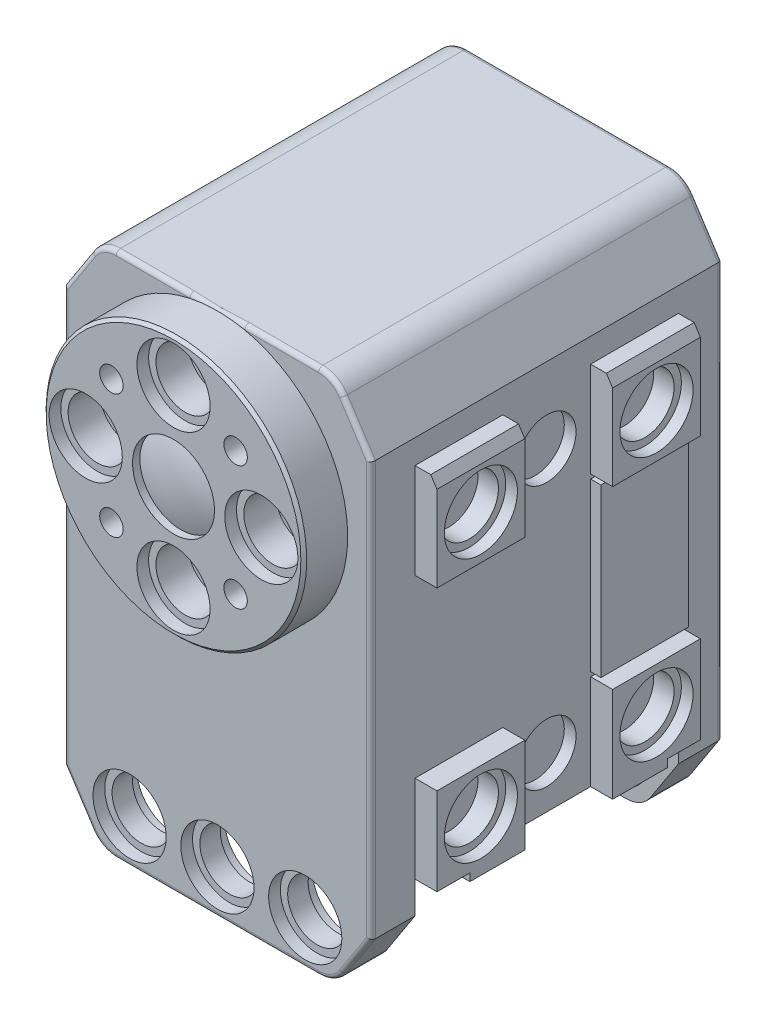
from build123d import *
from OCP.BRepFilletAPI import BRepFilletAPI_MakeChamfer

# Parameters (mm, degrees)
BOSS_EXTRUDE1_DEPTH                                = 18.75
CUT_EXTRUDE1_DEPTH                                 = 13.5
CUT_EXTRUDE2_DEPTH                                 = 2.25
SKETCH5_W                                          = 3.75
SKETCH5_H                                          = 26.65033759
BOSS_EXTRUDE2_DEPTH                                = 1.5
BOSS_EXTRUDE3_DEPTH                                = 1.5
BOSS_EXTRUDE4_DEPTH                                = 1.5
SKETCH8_W                                          = 3.75
SKETCH8_H                                          = 26.65033759
BOSS_EXTRUDE5_DEPTH                                = 1.5
SKETCH9_W                                          = 1.5
SKETCH9_H                                          = 3.75
CUT_EXTRUDE3_DEPTH                                 = 20.15033759
SKETCH10_W                                         = 1.5
SKETCH10_H                                         = 3.75
CUT_EXTRUDE4_DEPTH                                 = 20.15033759
BOSS_EXTRUDE6_START                                = 2.25
BOSS_EXTRUDE6_DEPTH                                = 2.25
BOSS_EXTRUDE7_DEPTH                                = 3
CUT_EXTRUDE5_START                                 = -0.8
SKETCH13_R                                         = 2.5
CUT_EXTRUDE5_DEPTH                                 = 0.8
SKETCH14_R                                         = 2.5
CUT_EXTRUDE6_DEPTH                                 = 0.8
CUT_EXTRUDE7_REACH                                 = 41.49
SKETCH15_R                                         = 2
CUT_EXTRUDE8_START                                 = -0.8
SKETCH18_R                                         = 2.5
CUT_EXTRUDE8_DEPTH                                 = 0.8
SKETCH19_R                                         = 2.5
CUT_EXTRUDE9_DEPTH                                 = 0.8
CUT_EXTRUDE10_REACH                                = 41.49
SKETCH20_R                                         = 2
SKETCH21_W                                         = 6
SKETCH21_H                                         = 6.5
BOSS_EXTRUDE8_DEPTH                                = 1.5
SKETCH22_W                                         = 6
SKETCH22_H                                         = 6.5
BOSS_EXTRUDE9_DEPTH                                = 1.5
SKETCH23_W                                         = 6
SKETCH23_H                                         = 11.4
BOSS_EXTRUDE10_DEPTH                               = 0.7
SKETCH24_W                                         = 6
SKETCH24_H                                         = 6.5
BOSS_EXTRUDE11_DEPTH                               = 1.5
SKETCH25_W                                         = 6
SKETCH25_H                                         = 6.5
BOSS_EXTRUDE12_DEPTH                               = 1.5
SKETCH26_W                                         = 6
SKETCH26_H                                         = 11.4
BOSS_EXTRUDE13_DEPTH                               = 0.7
CBORE_FOR_M3_5_HEX_HEAD_MACHINE_SCREW1_D           = 4
CBORE_FOR_M3_5_HEX_HEAD_MACHINE_SCREW1_DEPTH       = 3
CBORE_FOR_M3_5_HEX_HEAD_MACHINE_SCREW1_CBORE_D     = 5
CBORE_FOR_M3_5_HEX_HEAD_MACHINE_SCREW1_CBORE_DEPTH = 0.8
F_4_0_4_DIAMETER_HOLE1_D                           = 4
F_4_0_4_DIAMETER_HOLE1_DEPTH                       = 0.8
F_4_0_4_DIAMETER_HOLE2_D                           = 4
F_4_0_4_DIAMETER_HOLE2_DEPTH                       = 0.8
CBORE_FOR_M3_5_HEX_HEAD_MACHINE_SCREW2_D           = 4
CBORE_FOR_M3_5_HEX_HEAD_MACHINE_SCREW2_DEPTH       = 2.2
CBORE_FOR_M3_5_HEX_HEAD_MACHINE_SCREW2_CBORE_D     = 5
CBORE_FOR_M3_5_HEX_HEAD_MACHINE_SCREW2_CBORE_DEPTH = 0.8
F_1_6_1_6_DIAMETER_HOLE1_D                         = 1.6
F_1_6_1_6_DIAMETER_HOLE1_DEPTH                     = 3
CBORE_FOR_M3_5_HEX_HEAD_MACHINE_SCREW3_D           = 4
CBORE_FOR_M3_5_HEX_HEAD_MACHINE_SCREW3_DEPTH       = 2.2
CBORE_FOR_M3_5_HEX_HEAD_MACHINE_SCREW3_CBORE_D     = 5
CBORE_FOR_M3_5_HEX_HEAD_MACHINE_SCREW3_CBORE_DEPTH = 0.8
CBORE_FOR_M3_5_HEX_HEAD_MACHINE_SCREW4_D           = 4
CBORE_FOR_M3_5_HEX_HEAD_MACHINE_SCREW4_DEPTH       = 3
CBORE_FOR_M3_5_HEX_HEAD_MACHINE_SCREW4_CBORE_D     = 5
CBORE_FOR_M3_5_HEX_HEAD_MACHINE_SCREW4_CBORE_DEPTH = 0.8
FILLET1_R                                          = 2
CHAMFER1_SIZE                                      = 0.659459855
CHAMFER1_SIZE2                                     = 0.428258237
CHAMFER4_SIZE                                      = 0.200000001
FILLET2_R                                          = 0.3
SKETCH58_R                                         = 8.699999999
BOSS_EXTRUDE26_DEPTH                               = 45
SKETCH60_R                                         = 2
CUT_EXTRUDE17_DEPTH                                = 7
SKETCH61_W                                         = 7.92
SKETCH61_H                                         = 4
BOSS_EXTRUDE27_DEPTH                               = 10
FILLET5_R                                          = 0.4


with BuildPart() as part:
    # Sketch1 → Revolve1 (revolve)
    with BuildSketch(Plane.XZ):
        with BuildLine():
            Line((0, 15), (0, 12))
            Line((0, 12), (8.9, 12))
            Line((8.9, 12), (8.9, 15))
            Line((8.9, 15), (2.8, 15))
            Line((2.8, 15), (2.8, 14.5))
            ThreePointArc((2.8, 14.5), (1.422146265, 14.874019086), (0, 15))
        make_face()
    revolve(axis=Axis((0, 0, 15.000103078), (0, 0, -1)))

    # Sketch2 → Boss-Extrude1 (add)
    with BuildSketch(Plane.XY.offset(12)):
        Polygon((10.5, -23.15033759), (10.5, 5.15033759), (8, 9), (-8, 9), (-10.5, 5.15033759), (-10.5, -23.15033759), (-8, -27), (8, -27), align=None)
    extrude(amount=-BOSS_EXTRUDE1_DEPTH)

    # Sketch3 → Cut-Extrude1 (cut)
    with BuildSketch(Plane(origin=(0, 0, -6.75), x_dir=(-1, 0, 0), z_dir=(0, 0, -1))):
        with BuildLine():
            Line((-6, -21.5), (-10.5, -21.5))
            Line((-10.5, -21.5), (-10.5, -23.15033759))
            Line((-10.5, -23.15033759), (-8, -27))
            Line((-8, -27), (8, -27))
            Line((8, -27), (10.5, -23.15033759))
            Line((10.5, -23.15033759), (10.5, -21.5))
            Line((10.5, -21.5), (6, -21.5))
            ThreePointArc((6, -21.5), (4.881966011, -21.763932023), (4, -22.5))
            Line((4, -22.5), (-4, -22.5))
            ThreePointArc((-4, -22.5), (-4.881966011, -21.763932023), (-6, -21.5))
        make_face()
    extrude(amount=-CUT_EXTRUDE1_DEPTH, mode=Mode.SUBTRACT)

    # Sketch4 → Cut-Extrude2 (cut)
    with BuildSketch(Plane(origin=(0, 0, 6.75), x_dir=(-1, 0, 0), z_dir=(0, 0, -1))):
        with BuildLine():
            Line((-6, -20.975), (-10.5, -20.975))
            Line((-10.5, -20.975), (-10.5, -23.15033759))
            Line((-10.5, -23.15033759), (-8, -27))
            Line((-8, -27), (8, -27))
            Line((8, -27), (10.5, -23.15033759))
            Line((10.5, -23.15033759), (10.5, -20.975))
            Line((10.5, -20.975), (6, -20.975))
            ThreePointArc((6, -20.975), (4.48126286, -21.383884081), (3.373095929, -22.5))
            Line((3.373095929, -22.5), (-3.373095929, -22.5))
            ThreePointArc((-3.373095929, -22.5), (-4.48126286, -21.383884081), (-6, -20.975))
        make_face()
    extrude(amount=-CUT_EXTRUDE2_DEPTH, mode=Mode.SUBTRACT)

    # Sketch5 → Boss-Extrude2 (add)
    with BuildSketch(Plane(origin=(10.5, 0, 0), x_dir=(0, 0, -1), z_dir=(1, 0, 0))):
        with Locations((4.875, -8.174831205)):
            Rectangle(SKETCH5_W, SKETCH5_H)
    extrude(amount=BOSS_EXTRUDE2_DEPTH)

    # Sketch6 → Boss-Extrude3 (add)
    with BuildSketch(Plane(origin=(10.5, 0, 0), x_dir=(0, 0, -1), z_dir=(1, 0, 0))):
        Polygon((-9, -20.975), (-9, -15), (-3, -15), (-3, -21.5), (-6.75, -21.5), (-6.75, -20.975), align=None)
    extrude(amount=BOSS_EXTRUDE3_DEPTH)

    # Sketch7 → Boss-Extrude4 (add)
    with BuildSketch(Plane.ZY.offset(10.5)):
        Polygon((9, -15), (9, -20.975), (6.75, -20.975), (6.75, -21.5), (3, -21.5), (3, -15), align=None)
    extrude(amount=BOSS_EXTRUDE4_DEPTH)

    # Sketch8 → Boss-Extrude5 (add)
    with BuildSketch(Plane.ZY.offset(10.5)):
        with Locations((-4.875, -8.174831205)):
            Rectangle(SKETCH8_W, SKETCH8_H)
    extrude(amount=BOSS_EXTRUDE5_DEPTH)

    # Sketch9 → Cut-Extrude3 (cut)
    with BuildSketch(Plane(origin=(0, 5.15033759, 0), x_dir=(-1, 0, 0), z_dir=(0, 1, 0))):
        with Locations((-11.25, -4.875)):
            Rectangle(SKETCH9_W, SKETCH9_H)
    extrude(amount=-CUT_EXTRUDE3_DEPTH, mode=Mode.SUBTRACT)

    # Sketch10 → Cut-Extrude4 (cut)
    with BuildSketch(Plane(origin=(0, 5.15033759, 0), x_dir=(-1, 0, 0), z_dir=(0, 1, 0))):
        with Locations((11.25, -4.875)):
            Rectangle(SKETCH10_W, SKETCH10_H)
    extrude(amount=-CUT_EXTRUDE4_DEPTH, mode=Mode.SUBTRACT)

    # Sketch11 → Boss-Extrude6 (add)
    with BuildSketch(Plane(origin=(0, 0, -6.75), x_dir=(-1, 0, 0), z_dir=(0, 0, -1)).offset(BOSS_EXTRUDE6_START)):
        with BuildLine():
            Line((12, -20.975), (6, -20.975))
            ThreePointArc((6, -20.975), (4.48126286, -21.383884081), (3.373095929, -22.5))
            Line((3.373095929, -22.5), (-3.373095929, -22.5))
            ThreePointArc((-3.373095929, -22.5), (-4.48126286, -21.383884081), (-6, -20.975))
            Line((-6, -20.975), (-12, -20.975))
            Line((-12, -20.975), (-12, -15))
            Line((-12, -15), (-10.5, -15))
            Line((-10.5, -15), (-10.5, 5.15033759))
            Line((-10.5, 5.15033759), (-8, 9))
            Line((-8, 9), (8, 9))
            Line((8, 9), (10.5, 5.15033759))
            Line((10.5, 5.15033759), (10.5, -15))
            Line((10.5, -15), (12, -15))
            Line((12, -15), (12, -20.975))
        make_face()
    extrude(amount=-BOSS_EXTRUDE6_DEPTH)

    # Sketch12 → Boss-Extrude7 (add)
    with BuildSketch(Plane(origin=(0, 0, -9), x_dir=(-1, 0, 0), z_dir=(0, 0, -1))):
        Polygon((-8, 9), (8, 9), (10.5, 5.15033759), (10.5, -23.15033759), (8, -27), (-8, -27), (-10.5, -23.15033759), (-10.5, 5.15033759), align=None)
    extrude(amount=BOSS_EXTRUDE7_DEPTH)

    # Sketch13 → Cut-Extrude5 (cut)
    with BuildSketch(Plane.XY.offset(-9).offset(CUT_EXTRUDE5_START)):
        with Locations((-6, -24)):
            Circle(SKETCH13_R)
    extrude(amount=CUT_EXTRUDE5_DEPTH, mode=Mode.SUBTRACT)

    # Sketch14 → Cut-Extrude6 (cut)
    with BuildSketch(Plane(origin=(0, 0, -12), x_dir=(-1, 0, 0), z_dir=(0, 0, -1))):
        with Locations((6, -24)):
            Circle(SKETCH14_R)
    extrude(amount=-CUT_EXTRUDE6_DEPTH, mode=Mode.SUBTRACT)

    # Sketch15 → Cut-Extrude7 (cut, up to next)
    with BuildSketch(Plane(origin=(0, 0, -11.2), x_dir=(-1, 0, 0), z_dir=(0, 0, -1)), mode=Mode.PRIVATE) as cut_extrude7_sk1:
        with Locations((6, -24)):
            Circle(SKETCH15_R)
    cut_extrude7_tool1 = extrude(cut_extrude7_sk1.sketch, amount=-CUT_EXTRUDE7_REACH, mode=Mode.PRIVATE) & part.part
    add(cut_extrude7_tool1.solids().sort_by_distance((-6, -24, -11.2))[0], mode=Mode.SUBTRACT)

    # Sketch16 → M4x0.7 Tapped Hole1 (revolve, cut)
    with BuildSketch(Plane(origin=(0, -24, -9), x_dir=(0, -1, 0), z_dir=(1, 0, 0))):
        Polygon((0, 0), (0, 2.2), (2.5, 2.2), (2.5, 1.4), (2, 1.4), (2, 0), align=None)
    revolve(axis=Axis((0, -24, -2.65), (0, 0, -1)), mode=Mode.SUBTRACT)

    # Sketch18 → Cut-Extrude8 (cut)
    with BuildSketch(Plane.XY.offset(-9).offset(CUT_EXTRUDE8_START)):
        with Locations((6, -24)):
            Circle(SKETCH18_R)
    extrude(amount=CUT_EXTRUDE8_DEPTH, mode=Mode.SUBTRACT)

    # Sketch19 → Cut-Extrude9 (cut)
    with BuildSketch(Plane(origin=(0, 0, -12), x_dir=(-1, 0, 0), z_dir=(0, 0, -1))):
        with Locations((-6, -24)):
            Circle(SKETCH19_R)
    extrude(amount=-CUT_EXTRUDE9_DEPTH, mode=Mode.SUBTRACT)

    # Sketch20 → Cut-Extrude10 (cut, up to next)
    with BuildSketch(Plane(origin=(0, 0, -11.2), x_dir=(-1, 0, 0), z_dir=(0, 0, -1)), mode=Mode.PRIVATE) as cut_extrude10_sk1:
        with Locations((-6, -24)):
            Circle(SKETCH20_R)
    cut_extrude10_tool1 = extrude(cut_extrude10_sk1.sketch, amount=-CUT_EXTRUDE10_REACH, mode=Mode.PRIVATE) & part.part
    add(cut_extrude10_tool1.solids().sort_by_distance((6, -24, -11.2))[0], mode=Mode.SUBTRACT)

    # Sketch21 → Boss-Extrude8 (add)
    with BuildSketch(Plane(origin=(10.5, 0, 0), x_dir=(0, 0, -1), z_dir=(1, 0, 0))):
        with Locations((6, 0.25)):
            Rectangle(SKETCH21_W, SKETCH21_H)
    extrude(amount=BOSS_EXTRUDE8_DEPTH)

    # Sketch22 → Boss-Extrude9 (add)
    with BuildSketch(Plane(origin=(10.5, 0, 0), x_dir=(0, 0, -1), z_dir=(1, 0, 0))):
        with Locations((-6, 0.25)):
            Rectangle(SKETCH22_W, SKETCH22_H)
    extrude(amount=BOSS_EXTRUDE9_DEPTH)

    # Sketch23 → Boss-Extrude10 (add)
    with BuildSketch(Plane(origin=(10.5, 0, 0), x_dir=(0, 0, -1), z_dir=(1, 0, 0))):
        with Locations((6, -9)):
            Rectangle(SKETCH23_W, SKETCH23_H)
    extrude(amount=BOSS_EXTRUDE10_DEPTH)

    # Sketch24 → Boss-Extrude11 (add)
    with BuildSketch(Plane.ZY.offset(10.5)):
        with Locations((-6, 0.25)):
            Rectangle(SKETCH24_W, SKETCH24_H)
    extrude(amount=BOSS_EXTRUDE11_DEPTH)

    # Sketch25 → Boss-Extrude12 (add)
    with BuildSketch(Plane.ZY.offset(10.5)):
        with Locations((6, 0.25)):
            Rectangle(SKETCH25_W, SKETCH25_H)
    extrude(amount=BOSS_EXTRUDE12_DEPTH)

    # Sketch26 → Boss-Extrude13 (add)
    with BuildSketch(Plane.ZY.offset(10.5)):
        with Locations((-6, -9)):
            Rectangle(SKETCH26_W, SKETCH26_H)
    extrude(amount=BOSS_EXTRUDE13_DEPTH)

    # Sketch27 → Cut-Revolve1 (revolve, cut)
    with BuildSketch(Plane(origin=(0, -24, 0), x_dir=(1, 0, 0), z_dir=(0, 1, 0))):
        Polygon((8.5, -9), (6, -9), (6, -12), (8.5, -12), (8.5, -11.2), (8, -11.2), (8, -9.8), (8.5, -9.8), align=None)
    revolve(axis=Axis((6, -24, 9), (0, 0, 1)), mode=Mode.SUBTRACT)

    # Sketch28 → Cut-Revolve2 (revolve, cut)
    with BuildSketch(Plane(origin=(0, -24, 0), x_dir=(1, 0, 0), z_dir=(0, 1, 0))):
        Polygon((-3.5, -9), (-6, -9), (-6, -12), (-3.5, -12), (-3.5, -11.2), (-4, -11.2), (-4, -9.8), (-3.5, -9.8), align=None)
    revolve(axis=Axis((-6, -24, 9), (0, 0, 1)), mode=Mode.SUBTRACT)

    # Sketch29 → Cut-Revolve3 (revolve, cut)
    with BuildSketch(Plane(origin=(0, -24, 0), x_dir=(1, 0, 0), z_dir=(0, 1, 0))):
        Polygon((2.5, -9), (0, -9), (0, -12), (2.5, -12), (2.5, -11.2), (2, -11.2), (2, -9.8), (2.5, -9.8), align=None)
    revolve(axis=Axis((0, -24, 9), (0, 0, 1)), mode=Mode.SUBTRACT)

    # CBORE for M3.5 Hex Head Machine Screw1
    with Locations(Plane(origin=(0, 0, -12), x_dir=(-1, 0, 0), z_dir=(0, 0, -1))):
        with Locations((6, 0), (0, 0), (-6, 0)):
            CounterBoreHole(CBORE_FOR_M3_5_HEX_HEAD_MACHINE_SCREW1_D / 2, CBORE_FOR_M3_5_HEX_HEAD_MACHINE_SCREW1_CBORE_D / 2, CBORE_FOR_M3_5_HEX_HEAD_MACHINE_SCREW1_CBORE_DEPTH, depth=CBORE_FOR_M3_5_HEX_HEAD_MACHINE_SCREW1_DEPTH)

    # Ø4.0 (4) Diameter Hole1
    with Locations(Plane.ZY.offset(10.5)):
        with Locations((0, 0), (0, -18)):
            Hole(F_4_0_4_DIAMETER_HOLE1_D / 2, depth=F_4_0_4_DIAMETER_HOLE1_DEPTH)

    # Ø4.0 (4) Diameter Hole2
    with Locations(Plane(origin=(10.5, 0, 0), x_dir=(0, 0, -1), z_dir=(1, 0, 0))):
        with Locations((0, 0), (0, -18)):
            Hole(F_4_0_4_DIAMETER_HOLE2_D / 2, depth=F_4_0_4_DIAMETER_HOLE2_DEPTH)

    # CBORE for M3.5 Hex Head Machine Screw2
    with Locations(Plane.ZY.offset(12)):
        with Locations((6, -18), (-6, -18), (-6, 0), (6, 0)):
            CounterBoreHole(CBORE_FOR_M3_5_HEX_HEAD_MACHINE_SCREW2_D / 2, CBORE_FOR_M3_5_HEX_HEAD_MACHINE_SCREW2_CBORE_D / 2, CBORE_FOR_M3_5_HEX_HEAD_MACHINE_SCREW2_CBORE_DEPTH, depth=CBORE_FOR_M3_5_HEX_HEAD_MACHINE_SCREW2_DEPTH)

    # Ø1.6 (1.6) Diameter Hole1
    with Locations(Plane.XY.offset(15)):
        with Locations((4.242640687, 4.242640687), (-4.242640687, 4.242640687), (4.242640687, -4.242640687), (-4.242640687, -4.242640687)):
            Hole(F_1_6_1_6_DIAMETER_HOLE1_D / 2, depth=F_1_6_1_6_DIAMETER_HOLE1_DEPTH)

    # CBORE for M3.5 Hex Head Machine Screw3
    with Locations(Plane(origin=(12, 0, 0), x_dir=(0, 0, -1), z_dir=(1, 0, 0))):
        with Locations((6, -18), (-6, -18), (6, 0), (-6, 0)):
            CounterBoreHole(CBORE_FOR_M3_5_HEX_HEAD_MACHINE_SCREW3_D / 2, CBORE_FOR_M3_5_HEX_HEAD_MACHINE_SCREW3_CBORE_D / 2, CBORE_FOR_M3_5_HEX_HEAD_MACHINE_SCREW3_CBORE_DEPTH, depth=CBORE_FOR_M3_5_HEX_HEAD_MACHINE_SCREW3_DEPTH)

    # CBORE for M3.5 Hex Head Machine Screw4
    with Locations(Plane.XY.offset(15)):
        with Locations((6, 0), (0, 6), (-6, 0), (0, -6)):
            CounterBoreHole(CBORE_FOR_M3_5_HEX_HEAD_MACHINE_SCREW4_D / 2, CBORE_FOR_M3_5_HEX_HEAD_MACHINE_SCREW4_CBORE_D / 2, CBORE_FOR_M3_5_HEX_HEAD_MACHINE_SCREW4_CBORE_DEPTH, depth=CBORE_FOR_M3_5_HEX_HEAD_MACHINE_SCREW4_DEPTH)

    # Fillet1
    fillet1_edges = [part.edges().sort_by_distance(p)[0] for p in [
        (8, -27, -10.5),
        (8, -27, 10.5),
        (8, 9, 0),
        (-8, 9, 0),
        (-8, -27, -10.5),
        (-8, -27, 10.5),
    ]]
    fillet(fillet1_edges, radius=FILLET1_R)

    # Chamfer1: one chamfer whose edges measure the first distance from different faces: ONE call of the kernel's chamfer builder (chamfer() names one face for all edges)
    chamfer1_edges_1 = [part.edges().sort_by_distance(p)[0] for p in [
        (12, 3.5, -6),
    ]]
    chamfer1_side_1 = [part.faces().sort_by_distance(p)[0] for p in [
        (12, -2.91154097, -6),
    ]]
    chamfer1_edges_2 = [part.edges().sort_by_distance(p)[0] for p in [
        (12, 3.5, 6),
    ]]
    chamfer1_side_2 = [part.faces().sort_by_distance(p)[0] for p in [
        (12, 3.41154097, 6),
    ]]
    chamfer1_edges_3 = [part.edges().sort_by_distance(p)[0] for p in [
        (-12, 3.5, -6),
    ]]
    chamfer1_side_3 = [part.faces().sort_by_distance(p)[0] for p in [
        (-12, 3.41154097, -6),
    ]]
    chamfer1_edges_4 = [part.edges().sort_by_distance(p)[0] for p in [
        (-12, 3.5, 6),
    ]]
    chamfer1_side_4 = [part.faces().sort_by_distance(p)[0] for p in [
        (-12, -2.91154097, 6),
    ]]
    chamfer1 = BRepFilletAPI_MakeChamfer(part.part.solid().wrapped)
    for e in chamfer1_edges_1:
        chamfer1.Add(CHAMFER1_SIZE, CHAMFER1_SIZE2, e.wrapped, chamfer1_side_1[0].wrapped)  # the first distance lies on this face
    for e in chamfer1_edges_2:
        chamfer1.Add(CHAMFER1_SIZE, CHAMFER1_SIZE2, e.wrapped, chamfer1_side_2[0].wrapped)  # the first distance lies on this face
    for e in chamfer1_edges_3:
        chamfer1.Add(CHAMFER1_SIZE, CHAMFER1_SIZE2, e.wrapped, chamfer1_side_3[0].wrapped)  # the first distance lies on this face
    for e in chamfer1_edges_4:
        chamfer1.Add(CHAMFER1_SIZE, CHAMFER1_SIZE2, e.wrapped, chamfer1_side_4[0].wrapped)  # the first distance lies on this face
    add(Compound.cast(chamfer1.Shape()), mode=Mode.REPLACE)

    # Chamfer4
    chamfer4_edges = [part.edges().sort_by_distance(p)[0] for p in [
        (-8.9, 0, 15),
    ]]
    chamfer(chamfer4_edges, length=CHAMFER4_SIZE)

    # Fillet2
    fillet2_edges = [part.edges().sort_by_distance(p)[0] for p in [
        (-9.545714868, -24.61980783, 12),
        (-7.868406121, -26.757634225, 12),
        (0, -27, 12),
        (7.868406121, -26.757634225, 12),
        (9.545714868, -24.61980783, 12),
        (10.5, -9, 12),
        (-10.5, -9, 12),
        (9.545714868, 6.61980783, 12),
        (7.868406121, 8.757634225, 12),
        (0, 9, 12),
        (-7.868406121, 8.757634225, 12),
        (-9.545714868, 6.61980783, 12),
        (9.545714868, -24.61980783, -12),
        (-9.545714868, -24.61980783, -12),
        (7.868406121, -26.757634225, -12),
        (-7.868406121, -26.757634225, -12),
        (0, -27, -12),
        (-10.5, -9, -12),
        (10.5, -9, -12),
        (-9.545714868, 6.61980783, -12),
        (9.545714868, 6.61980783, -12),
        (-7.868406121, 8.757634225, -12),
        (7.868406121, 8.757634225, -12),
        (0, 9, -12),
    ]]
    fillet(fillet2_edges, radius=FILLET2_R)


with BuildPart() as body_2:
    # Sketch58 → Boss-Extrude26 (new body)
    with BuildSketch(Plane.XY.offset(15)):
        Circle(SKETCH58_R)
    extrude(amount=BOSS_EXTRUDE26_DEPTH)

    # Sketch60 → Cut-Extrude17 (cut)
    with BuildSketch(Plane(origin=(0, 0, 15), x_dir=(-1, 0, 0), z_dir=(0, 0, -1))):
        with Locations((-6, 0)):
            Circle(SKETCH60_R)
        with Locations((0, -6)):
            Circle(SKETCH60_R)
        with Locations((6, 0)):
            Circle(SKETCH60_R)
        with Locations((0, 6)):
            Circle(SKETCH60_R)
    extrude(amount=-CUT_EXTRUDE17_DEPTH, mode=Mode.SUBTRACT)


with BuildPart() as body_3:
    # Sketch61 → Boss-Extrude27 (new body)
    with BuildSketch(Plane.XY.offset(60)):
        with Locations((0.172745052, -6.698284839)):
            Rectangle(SKETCH61_W, SKETCH61_H)
    extrude(amount=-BOSS_EXTRUDE27_DEPTH)

    # Fillet5
    fillet5_edges = [body_3.edges().sort_by_distance(p)[0] for p in [
        (4.132745052, -8.698284839, 55),
        (0.172745052, -8.698284839, 50),
        (-3.787254948, -8.698284839, 55),
    ]]
    fillet(fillet5_edges, radius=FILLET5_R)


solid = part.part
